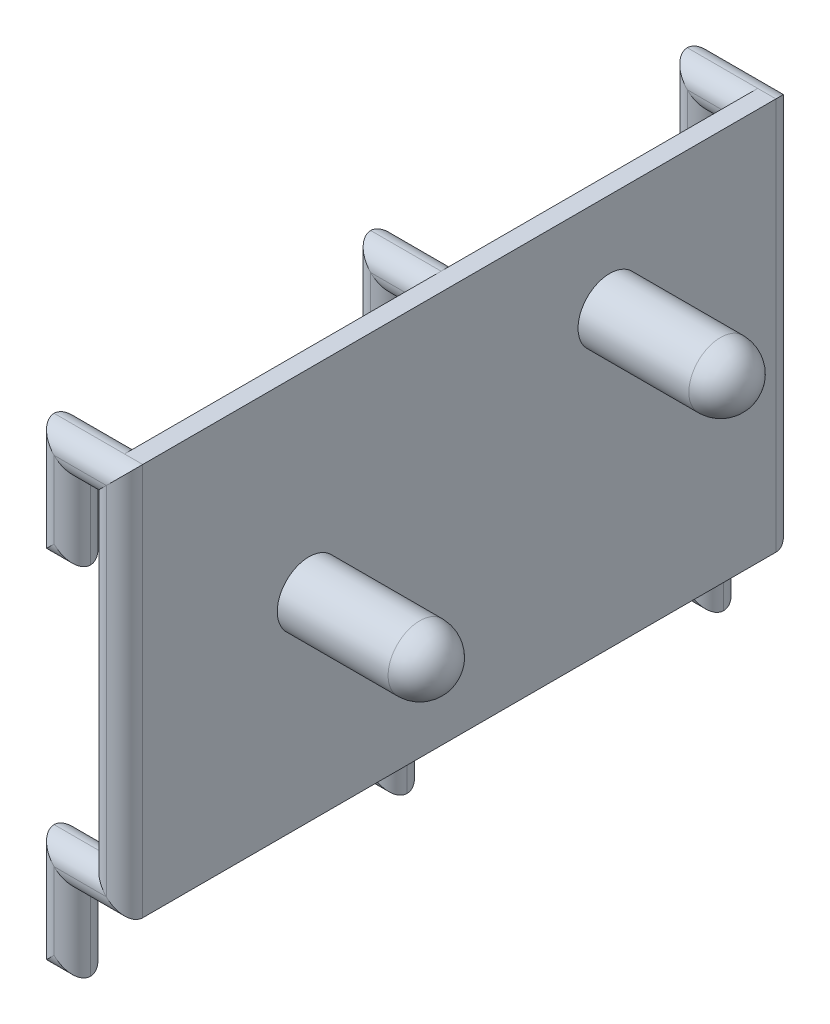
from build123d import *

# Parameters (mm, degrees)
EXTRU_MINCE1_DEPTH           = 2.3
CONG_1_R                     = 2.3
ESQUISSE2_W                  = 80
ESQUISSE2_H                  = 49.6
BOSS_EXTRU_1_DEPTH           = 2.3
R_P_TITION_START             = 77.7
R_P_TITION_LIN_AIRE1_DEPTH   = 4.6
R_P_TITION_START_2           = 37.7
R_P_TITION_LIN_AIRE1_2_DEPTH = 4.6
CONG_2_R                     = 2.3
ESQUISSE3_R                  = 4
BOSS_EXTRU_2_DEPTH           = 18
CONG_3_R                     = 4


# Read off the part's stored shape, not the designer's step: Répétition linéaire1
with BuildPart() as part:
    # Esquisse1 → Extru.-Mince1 (new, symmetric)
    with BuildSketch(Plane.XY):
        Polygon((-4.3, -57), (-4.3, -47.3), (2.3, -47.3), (2.3, 2.3), (-8.9, 2.3), (-8.9, -12), (-4.3, -12), (-4.3, -2.3), (-2.3, -2.3), (-2.3, -42.7), (-8.9, -42.7), (-8.9, -57), align=None)
    extrude(amount=EXTRU_MINCE1_DEPTH, both=True)

    # Congé1
    cong_1_edges = [part.edges().sort_by_distance(p)[0] for p in [
        (-6.6, -57, -2.3),
        (-4.3, -52.15, -2.3),
        (-1, -47.3, -2.3),
        (2.3, -22.5, -2.3),
        (-3.3, 2.3, -2.3),
        (-8.9, -4.85, -2.3),
        (-6.6, -12, -2.3),
        (-4.3, -7.15, -2.3),
        (-3.3, -2.3, -2.3),
        (-2.3, -22.5, -2.3),
        (-5.6, -42.7, -2.3),
        (-8.9, -49.85, -2.3),
        (-5.6, -42.7, 2.3),
        (-2.3, -22.5, 2.3),
        (-3.3, -2.3, 2.3),
        (-4.3, -7.15, 2.3),
        (-6.6, -12, 2.3),
        (-8.9, -4.85, 2.3),
        (-3.3, 2.3, 2.3),
        (2.3, -22.5, 2.3),
        (-1, -47.3, 2.3),
        (-4.3, -52.15, 2.3),
        (-6.6, -57, 2.3),
        (-8.9, -49.85, 2.3),
    ]]
    fillet(cong_1_edges, radius=CONG_1_R - 0.0001)  # a hair under: the kernel refuses the full size

    # Esquisse2 → Boss.-Extru.1 (add)
    with BuildSketch(Plane(origin=(0, 0, 0), x_dir=(0, 0, -1), z_dir=(1, 0, 0))):
        with Locations((-40, -22.5)):
            Rectangle(ESQUISSE2_W, ESQUISSE2_H)
    extrude(amount=BOSS_EXTRU_1_DEPTH)

    # Répétition linéaire1 outline → Répétition linéaire1 (add)
    with BuildSketch(Plane.XY.offset(R_P_TITION_START)):
        Polygon((-8.9, 2.3), (-8.9, -12), (-4.3, -12), (-4.3, -2.3), (-2.3, -2.3), (-2.3, -42.7), (-8.9, -42.7), (-8.9, -57), (-4.3, -57), (-4.3, -47.3), (2.3, -47.3), (2.3, 2.3), align=None)
    extrude(amount=R_P_TITION_LIN_AIRE1_DEPTH)

    # R_p_tition lin_aire1 2 outline → R_p_tition lin_aire1 2 (add)
    with BuildSketch(Plane.XY.offset(R_P_TITION_START_2)):
        Polygon((0, 2.3), (-8.9, 2.3), (-8.9, -12), (-4.3, -12), (-4.3, -2.3), (-2.3, -2.3), (-2.3, -42.7), (-8.9, -42.7), (-8.9, -57), (-4.3, -57), (-4.3, -47.3), (0, -47.3), align=None)
    extrude(amount=R_P_TITION_LIN_AIRE1_2_DEPTH)

    # Congé2
    cong_2_edges = [part.edges().sort_by_distance(p)[0] for p in [
        (-5.6, -42.7, 42.3),
        (-2.3, -22.5, 42.3),
        (-3.3, -2.3, 42.3),
        (-4.3, -7.15, 42.3),
        (-6.6, -12, 42.3),
        (-8.9, -4.85, 42.3),
        (-4.45, 2.3, 42.3),
        (-2.15, -47.3, 42.3),
        (-4.3, -52.15, 42.3),
        (-6.6, -57, 42.3),
        (-8.9, -49.85, 42.3),
        (-2.15, -47.3, 37.7),
        (-4.3, -52.15, 37.7),
        (-6.6, -57, 37.7),
        (-8.9, -49.85, 37.7),
        (-5.6, -42.7, 37.7),
        (-2.3, -22.5, 37.7),
        (-3.3, -2.3, 37.7),
        (-4.3, -7.15, 37.7),
        (-6.6, -12, 37.7),
        (-8.9, -4.85, 37.7),
        (-4.45, 2.3, 37.7),
        (-5.6, -42.7, 82.3),
        (-2.3, -22.5, 82.3),
        (-3.3, -2.3, 82.3),
        (-4.3, -7.15, 82.3),
        (-6.6, -12, 82.3),
        (-8.9, -4.85, 82.3),
        (-3.3, 2.3, 82.3),
        (2.3, -22.5, 82.3),
        (-1, -47.3, 82.3),
        (-4.3, -52.15, 82.3),
        (-6.6, -57, 82.3),
        (-8.9, -49.85, 82.3),
        (-2.15, -47.3, 77.7),
        (-4.3, -52.15, 77.7),
        (-6.6, -57, 77.7),
        (-8.9, -49.85, 77.7),
        (-5.6, -42.7, 77.7),
        (-2.3, -22.5, 77.7),
        (-3.3, -2.3, 77.7),
        (-4.3, -7.15, 77.7),
        (-6.6, -12, 77.7),
        (-8.9, -4.85, 77.7),
        (-4.45, 2.3, 77.7),
    ]]
    fillet(cong_2_edges, radius=CONG_2_R - 0.0001)  # a hair under: the kernel refuses the full size

    # Esquisse3 → Boss.-Extru.2 (add)
    with BuildSketch(Plane(origin=(2.3, 0, 0), x_dir=(0, 0, -1), z_dir=(1, 0, 0))):
        with Locations((-59, -22.3)):
            Circle(ESQUISSE3_R)
        with Locations((-21, -10.3)):
            Circle(ESQUISSE3_R)
    extrude(amount=BOSS_EXTRU_2_DEPTH)

    # Congé3
    cong_3_edges = [part.edges().sort_by_distance(p)[0] for p in [
        (20.3, -22.3, 63),
        (20.3, -10.3, 25),
    ]]
    fillet(cong_3_edges, radius=CONG_3_R)


solid = part.part
